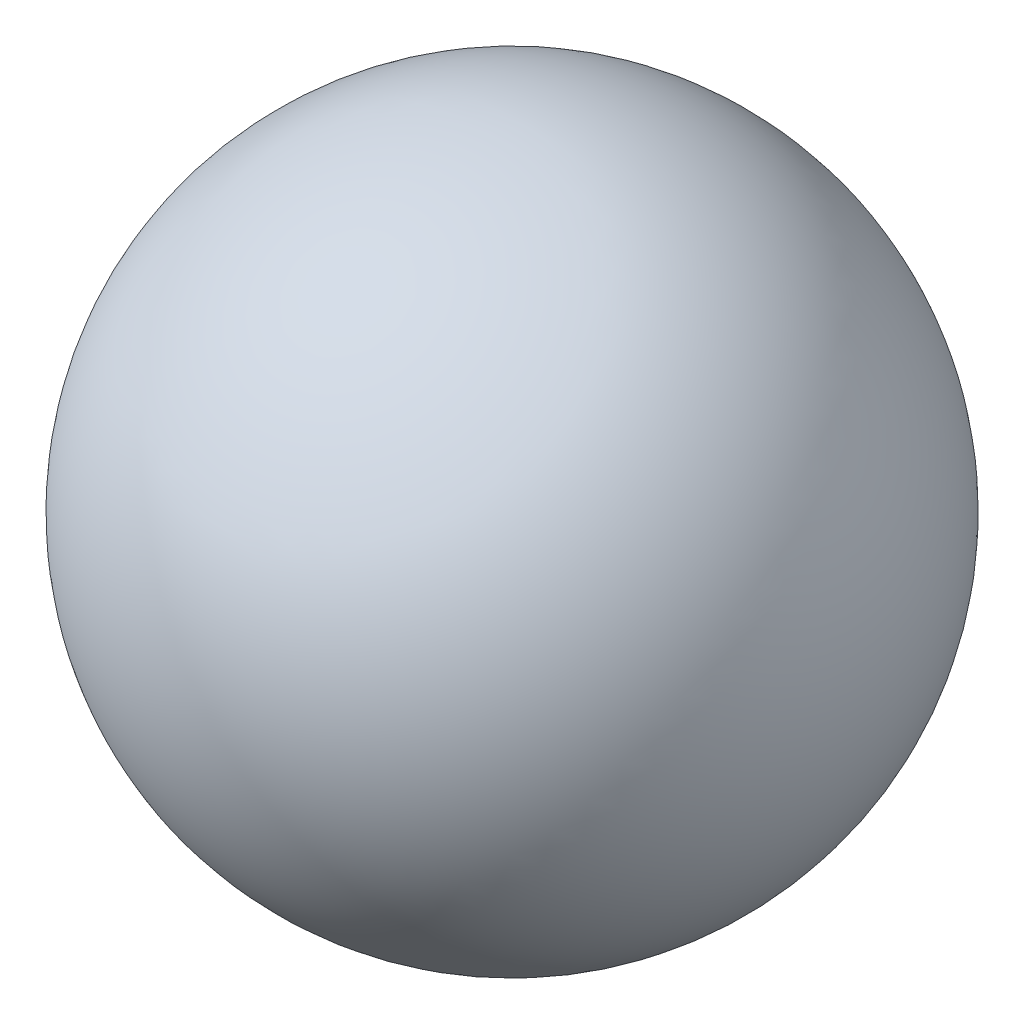
from build123d import *


with BuildPart() as part:
    # Sketch1 → Revolve2 (revolve)
    with BuildSketch(Plane(origin=(0, 0, 0), x_dir=(1, 0, 0), z_dir=(0, 1, 0))):
        with BuildLine():
            ThreePointArc((0, 7.6073), (-7.6073, 0), (0, -7.6073))
            Line((0, -7.6073), (0, 7.6073))
        make_face()
    revolve(axis=Axis((0, 0, 7.6073), (0, 0, -1)))


solid = part.part
